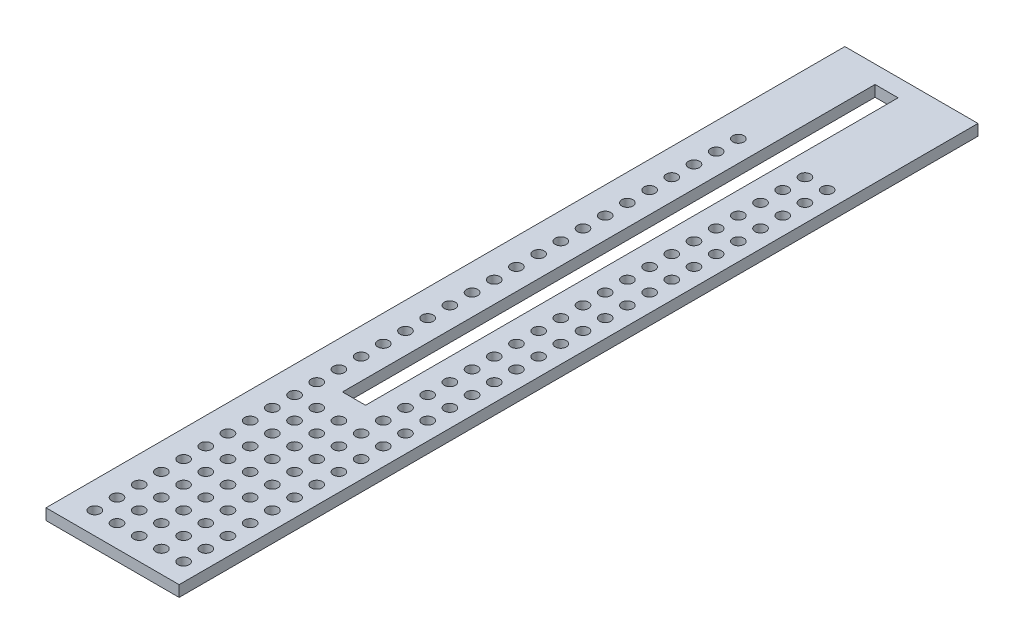
from build123d import *

# Parameters (mm, degrees)
BOSS_EXTRUDE1_DEPTH = 228.6
CUT_EXTRUDE1_REACH  = 239.256
SKETCH3_W           = 76.2
SKETCH3_H           = 6.35
SKETCH3_H_2         = 6.941694096
SKETCH4_R           = 1.5875
CUT_EXTRUDE2_DEPTH  = 3.175
CUT_EXTRUDE3_REACH  = 254.812
SKETCH5_W           = 6.604
SKETCH5_H           = 152.4
SKETCH6_R           = 1.5875
CUT_EXTRUDE4_DEPTH  = 3.175
CUT_EXTRUDE5_REACH  = 239.256
SKETCH7_W           = 228.6
SKETCH7_H           = 98.425


with BuildPart() as part:
    # Sketch1 → Boss-Extrude1 (new body)
    with BuildSketch(Plane.XY):
        Polygon((1.5875, 47.625), (36.5125, 47.625), (36.5125, 50.8), (-1.5875, 50.8), (-1.5875, -50.8), (1.5875, -50.8), align=None)
    extrude(amount=BOSS_EXTRUDE1_DEPTH)

    # Sketch3 → Cut-Extrude1 (cut, up to next)
    with BuildSketch(Plane.ZY.offset(1.5875), mode=Mode.PRIVATE) as cut_extrude1_sk1:
        with Locations((44.45, -35.56)):
            Rectangle(SKETCH3_W, SKETCH3_H)
    cut_extrude1_tool1 = extrude(cut_extrude1_sk1.sketch, amount=-CUT_EXTRUDE1_REACH, mode=Mode.PRIVATE) & part.part
    # Sketch3 → Cut-Extrude1 (cut, up to next)
    with BuildSketch(Plane.ZY.offset(1.5875), mode=Mode.PRIVATE) as cut_extrude1_sk2:
        with Locations((44.45, 29.718)):
            Rectangle(SKETCH3_W, SKETCH3_H_2)
    cut_extrude1_tool2 = extrude(cut_extrude1_sk2.sketch, amount=-CUT_EXTRUDE1_REACH, mode=Mode.PRIVATE) & part.part
    add(cut_extrude1_tool1.solids().sort_by_distance((-1.5875, -35.56, 44.45))[0], mode=Mode.SUBTRACT)
    add(cut_extrude1_tool2.solids().sort_by_distance((-1.5875, 29.718, 44.45))[0], mode=Mode.SUBTRACT)

    # Sketch4 → Cut-Extrude2 (cut)
    with BuildSketch(Plane.ZY.offset(1.5875)):
        with Locations(Location((103.818466909, 40.328941299, 0), (0, 0, 270))):
            Circle(SKETCH4_R)
        with Locations(Location((110.168466909, 40.328941299, 0), (0, 0, 270))):
            Circle(SKETCH4_R)
        with Locations(Location((116.518466909, 40.328941299, 0), (0, 0, 270))):
            Circle(SKETCH4_R)
        with Locations(Location((122.868466909, 40.328941299, 0), (0, 0, 270))):
            Circle(SKETCH4_R)
        with Locations(Location((129.218466909, 40.328941299, 0), (0, 0, 270))):
            Circle(SKETCH4_R)
        with Locations(Location((110.168466909, 33.978941299, 0), (0, 0, 270))):
            Circle(SKETCH4_R)
        with Locations(Location((116.518466909, 33.978941299, 0), (0, 0, 270))):
            Circle(SKETCH4_R)
        with Locations(Location((122.868466909, 33.978941299, 0), (0, 0, 270))):
            Circle(SKETCH4_R)
        with Locations(Location((129.218466909, 33.978941299, 0), (0, 0, 270))):
            Circle(SKETCH4_R)
        with Locations(Location((110.168466909, 27.628941299, 0), (0, 0, 270))):
            Circle(SKETCH4_R)
        with Locations(Location((116.518466909, 27.628941299, 0), (0, 0, 270))):
            Circle(SKETCH4_R)
        with Locations(Location((122.868466909, 27.628941299, 0), (0, 0, 270))):
            Circle(SKETCH4_R)
        with Locations(Location((129.218466909, 27.628941299, 0), (0, 0, 270))):
            Circle(SKETCH4_R)
        with Locations(Location((110.168466909, 21.278941299, 0), (0, 0, 270))):
            Circle(SKETCH4_R)
        with Locations(Location((116.518466909, 21.278941299, 0), (0, 0, 270))):
            Circle(SKETCH4_R)
        with Locations(Location((122.868466909, 21.278941299, 0), (0, 0, 270))):
            Circle(SKETCH4_R)
        with Locations(Location((129.218466909, 21.278941299, 0), (0, 0, 270))):
            Circle(SKETCH4_R)
        with Locations(Location((103.818466909, 33.978941299, 0), (0, 0, 270))):
            Circle(SKETCH4_R)
        with Locations(Location((103.818466909, 27.628941299, 0), (0, 0, 270))):
            Circle(SKETCH4_R)
        with Locations(Location((103.818466909, 21.278941299, 0), (0, 0, 270))):
            Circle(SKETCH4_R)
        with Locations(Location((135.568466909, 40.328941299, 0), (0, 0, 270))):
            Circle(SKETCH4_R)
        with Locations(Location((141.918466909, 40.328941299, 0), (0, 0, 270))):
            Circle(SKETCH4_R)
        with Locations(Location((148.268466909, 40.328941299, 0), (0, 0, 270))):
            Circle(SKETCH4_R)
        with Locations(Location((154.618466909, 40.328941299, 0), (0, 0, 270))):
            Circle(SKETCH4_R)
        with Locations(Location((160.968466909, 40.328941299, 0), (0, 0, 270))):
            Circle(SKETCH4_R)
        with Locations(Location((167.318466909, 40.328941299, 0), (0, 0, 270))):
            Circle(SKETCH4_R)
        with Locations(Location((173.668466909, 40.328941299, 0), (0, 0, 270))):
            Circle(SKETCH4_R)
        with Locations(Location((180.018466909, 40.328941299, 0), (0, 0, 270))):
            Circle(SKETCH4_R)
        with Locations(Location((186.368466909, 40.328941299, 0), (0, 0, 270))):
            Circle(SKETCH4_R)
        with Locations(Location((192.718466909, 40.328941299, 0), (0, 0, 270))):
            Circle(SKETCH4_R)
        with Locations(Location((199.068466909, 40.328941299, 0), (0, 0, 270))):
            Circle(SKETCH4_R)
        with Locations(Location((205.418466909, 40.328941299, 0), (0, 0, 270))):
            Circle(SKETCH4_R)
        with Locations(Location((211.768466909, 40.328941299, 0), (0, 0, 270))):
            Circle(SKETCH4_R)
        with Locations(Location((218.118466909, 40.328941299, 0), (0, 0, 270))):
            Circle(SKETCH4_R)
        with Locations(Location((135.568466909, 33.978941299, 0), (0, 0, 270))):
            Circle(SKETCH4_R)
        with Locations(Location((141.918466909, 33.978941299, 0), (0, 0, 270))):
            Circle(SKETCH4_R)
        with Locations(Location((148.268466909, 33.978941299, 0), (0, 0, 270))):
            Circle(SKETCH4_R)
        with Locations(Location((154.618466909, 33.978941299, 0), (0, 0, 270))):
            Circle(SKETCH4_R)
        with Locations(Location((160.968466909, 33.978941299, 0), (0, 0, 270))):
            Circle(SKETCH4_R)
        with Locations(Location((167.318466909, 33.978941299, 0), (0, 0, 270))):
            Circle(SKETCH4_R)
        with Locations(Location((173.668466909, 33.978941299, 0), (0, 0, 270))):
            Circle(SKETCH4_R)
        with Locations(Location((180.018466909, 33.978941299, 0), (0, 0, 270))):
            Circle(SKETCH4_R)
        with Locations(Location((186.368466909, 33.978941299, 0), (0, 0, 270))):
            Circle(SKETCH4_R)
        with Locations(Location((192.718466909, 33.978941299, 0), (0, 0, 270))):
            Circle(SKETCH4_R)
        with Locations(Location((199.068466909, 33.978941299, 0), (0, 0, 270))):
            Circle(SKETCH4_R)
        with Locations(Location((205.418466909, 33.978941299, 0), (0, 0, 270))):
            Circle(SKETCH4_R)
        with Locations(Location((211.768466909, 33.978941299, 0), (0, 0, 270))):
            Circle(SKETCH4_R)
        with Locations(Location((218.118466909, 33.978941299, 0), (0, 0, 270))):
            Circle(SKETCH4_R)
        with Locations(Location((135.568466909, 27.628941299, 0), (0, 0, 270))):
            Circle(SKETCH4_R)
        with Locations(Location((141.918466909, 27.628941299, 0), (0, 0, 270))):
            Circle(SKETCH4_R)
        with Locations(Location((148.268466909, 27.628941299, 0), (0, 0, 270))):
            Circle(SKETCH4_R)
        with Locations(Location((154.618466909, 27.628941299, 0), (0, 0, 270))):
            Circle(SKETCH4_R)
        with Locations(Location((160.968466909, 27.628941299, 0), (0, 0, 270))):
            Circle(SKETCH4_R)
        with Locations(Location((167.318466909, 27.628941299, 0), (0, 0, 270))):
            Circle(SKETCH4_R)
        with Locations(Location((173.668466909, 27.628941299, 0), (0, 0, 270))):
            Circle(SKETCH4_R)
        with Locations(Location((180.018466909, 27.628941299, 0), (0, 0, 270))):
            Circle(SKETCH4_R)
        with Locations(Location((186.368466909, 27.628941299, 0), (0, 0, 270))):
            Circle(SKETCH4_R)
        with Locations(Location((192.718466909, 27.628941299, 0), (0, 0, 270))):
            Circle(SKETCH4_R)
        with Locations(Location((199.068466909, 27.628941299, 0), (0, 0, 270))):
            Circle(SKETCH4_R)
        with Locations(Location((205.418466909, 27.628941299, 0), (0, 0, 270))):
            Circle(SKETCH4_R)
        with Locations(Location((211.768466909, 27.628941299, 0), (0, 0, 270))):
            Circle(SKETCH4_R)
        with Locations(Location((218.118466909, 27.628941299, 0), (0, 0, 270))):
            Circle(SKETCH4_R)
        with Locations(Location((135.568466909, 21.278941299, 0), (0, 0, 270))):
            Circle(SKETCH4_R)
        with Locations(Location((141.918466909, 21.278941299, 0), (0, 0, 270))):
            Circle(SKETCH4_R)
        with Locations(Location((148.268466909, 21.278941299, 0), (0, 0, 270))):
            Circle(SKETCH4_R)
        with Locations(Location((154.618466909, 21.278941299, 0), (0, 0, 270))):
            Circle(SKETCH4_R)
        with Locations(Location((160.968466909, 21.278941299, 0), (0, 0, 270))):
            Circle(SKETCH4_R)
        with Locations(Location((167.318466909, 21.278941299, 0), (0, 0, 270))):
            Circle(SKETCH4_R)
        with Locations(Location((173.668466909, 21.278941299, 0), (0, 0, 270))):
            Circle(SKETCH4_R)
        with Locations(Location((180.018466909, 21.278941299, 0), (0, 0, 270))):
            Circle(SKETCH4_R)
        with Locations(Location((186.368466909, 21.278941299, 0), (0, 0, 270))):
            Circle(SKETCH4_R)
        with Locations(Location((192.718466909, 21.278941299, 0), (0, 0, 270))):
            Circle(SKETCH4_R)
        with Locations(Location((199.068466909, 21.278941299, 0), (0, 0, 270))):
            Circle(SKETCH4_R)
        with Locations(Location((205.418466909, 21.278941299, 0), (0, 0, 270))):
            Circle(SKETCH4_R)
        with Locations(Location((211.768466909, 21.278941299, 0), (0, 0, 270))):
            Circle(SKETCH4_R)
        with Locations(Location((218.118466909, 21.278941299, 0), (0, 0, 270))):
            Circle(SKETCH4_R)
        with Locations(Location((103.818466909, 14.928941299, 0), (0, 0, 270))):
            Circle(SKETCH4_R)
        with Locations(Location((110.168466909, 14.928941299, 0), (0, 0, 270))):
            Circle(SKETCH4_R)
        with Locations(Location((116.518466909, 14.928941299, 0), (0, 0, 270))):
            Circle(SKETCH4_R)
        with Locations(Location((122.868466909, 14.928941299, 0), (0, 0, 270))):
            Circle(SKETCH4_R)
        with Locations(Location((129.218466909, 14.928941299, 0), (0, 0, 270))):
            Circle(SKETCH4_R)
        with Locations(Location((135.568466909, 14.928941299, 0), (0, 0, 270))):
            Circle(SKETCH4_R)
        with Locations(Location((141.918466909, 14.928941299, 0), (0, 0, 270))):
            Circle(SKETCH4_R)
        with Locations(Location((148.268466909, 14.928941299, 0), (0, 0, 270))):
            Circle(SKETCH4_R)
        with Locations(Location((154.618466909, 14.928941299, 0), (0, 0, 270))):
            Circle(SKETCH4_R)
        with Locations(Location((160.968466909, 14.928941299, 0), (0, 0, 270))):
            Circle(SKETCH4_R)
        with Locations(Location((167.318466909, 14.928941299, 0), (0, 0, 270))):
            Circle(SKETCH4_R)
        with Locations(Location((173.668466909, 14.928941299, 0), (0, 0, 270))):
            Circle(SKETCH4_R)
        with Locations(Location((180.018466909, 14.928941299, 0), (0, 0, 270))):
            Circle(SKETCH4_R)
        with Locations(Location((186.368466909, 14.928941299, 0), (0, 0, 270))):
            Circle(SKETCH4_R)
        with Locations(Location((192.718466909, 14.928941299, 0), (0, 0, 270))):
            Circle(SKETCH4_R)
        with Locations(Location((199.068466909, 14.928941299, 0), (0, 0, 270))):
            Circle(SKETCH4_R)
        with Locations(Location((205.418466909, 14.928941299, 0), (0, 0, 270))):
            Circle(SKETCH4_R)
        with Locations(Location((211.768466909, 14.928941299, 0), (0, 0, 270))):
            Circle(SKETCH4_R)
        with Locations(Location((218.118466909, 14.928941299, 0), (0, 0, 270))):
            Circle(SKETCH4_R)
        with Locations(Location((103.818466909, 8.578941299, 0), (0, 0, 270))):
            Circle(SKETCH4_R)
        with Locations(Location((110.168466909, 8.578941299, 0), (0, 0, 270))):
            Circle(SKETCH4_R)
        with Locations(Location((116.518466909, 8.578941299, 0), (0, 0, 270))):
            Circle(SKETCH4_R)
        with Locations(Location((122.868466909, 8.578941299, 0), (0, 0, 270))):
            Circle(SKETCH4_R)
        with Locations(Location((129.218466909, 8.578941299, 0), (0, 0, 270))):
            Circle(SKETCH4_R)
        with Locations(Location((135.568466909, 8.578941299, 0), (0, 0, 270))):
            Circle(SKETCH4_R)
        with Locations(Location((141.918466909, 8.578941299, 0), (0, 0, 270))):
            Circle(SKETCH4_R)
        with Locations(Location((148.268466909, 8.578941299, 0), (0, 0, 270))):
            Circle(SKETCH4_R)
        with Locations(Location((154.618466909, 8.578941299, 0), (0, 0, 270))):
            Circle(SKETCH4_R)
        with Locations(Location((160.968466909, 8.578941299, 0), (0, 0, 270))):
            Circle(SKETCH4_R)
        with Locations(Location((167.318466909, 8.578941299, 0), (0, 0, 270))):
            Circle(SKETCH4_R)
        with Locations(Location((173.668466909, 8.578941299, 0), (0, 0, 270))):
            Circle(SKETCH4_R)
        with Locations(Location((180.018466909, 8.578941299, 0), (0, 0, 270))):
            Circle(SKETCH4_R)
        with Locations(Location((186.368466909, 8.578941299, 0), (0, 0, 270))):
            Circle(SKETCH4_R)
        with Locations(Location((192.718466909, 8.578941299, 0), (0, 0, 270))):
            Circle(SKETCH4_R)
        with Locations(Location((199.068466909, 8.578941299, 0), (0, 0, 270))):
            Circle(SKETCH4_R)
        with Locations(Location((205.418466909, 8.578941299, 0), (0, 0, 270))):
            Circle(SKETCH4_R)
        with Locations(Location((211.768466909, 8.578941299, 0), (0, 0, 270))):
            Circle(SKETCH4_R)
        with Locations(Location((218.118466909, 8.578941299, 0), (0, 0, 270))):
            Circle(SKETCH4_R)
        with Locations(Location((103.818466909, 2.228941299, 0), (0, 0, 270))):
            Circle(SKETCH4_R)
        with Locations(Location((110.168466909, 2.228941299, 0), (0, 0, 270))):
            Circle(SKETCH4_R)
        with Locations(Location((116.518466909, 2.228941299, 0), (0, 0, 270))):
            Circle(SKETCH4_R)
        with Locations(Location((122.868466909, 2.228941299, 0), (0, 0, 270))):
            Circle(SKETCH4_R)
        with Locations(Location((129.218466909, 2.228941299, 0), (0, 0, 270))):
            Circle(SKETCH4_R)
        with Locations(Location((135.568466909, 2.228941299, 0), (0, 0, 270))):
            Circle(SKETCH4_R)
        with Locations(Location((141.918466909, 2.228941299, 0), (0, 0, 270))):
            Circle(SKETCH4_R)
        with Locations(Location((148.268466909, 2.228941299, 0), (0, 0, 270))):
            Circle(SKETCH4_R)
        with Locations(Location((154.618466909, 2.228941299, 0), (0, 0, 270))):
            Circle(SKETCH4_R)
        with Locations(Location((160.968466909, 2.228941299, 0), (0, 0, 270))):
            Circle(SKETCH4_R)
        with Locations(Location((167.318466909, 2.228941299, 0), (0, 0, 270))):
            Circle(SKETCH4_R)
        with Locations(Location((173.668466909, 2.228941299, 0), (0, 0, 270))):
            Circle(SKETCH4_R)
        with Locations(Location((180.018466909, 2.228941299, 0), (0, 0, 270))):
            Circle(SKETCH4_R)
        with Locations(Location((186.368466909, 2.228941299, 0), (0, 0, 270))):
            Circle(SKETCH4_R)
        with Locations(Location((192.718466909, 2.228941299, 0), (0, 0, 270))):
            Circle(SKETCH4_R)
        with Locations(Location((199.068466909, 2.228941299, 0), (0, 0, 270))):
            Circle(SKETCH4_R)
        with Locations(Location((205.418466909, 2.228941299, 0), (0, 0, 270))):
            Circle(SKETCH4_R)
        with Locations(Location((211.768466909, 2.228941299, 0), (0, 0, 270))):
            Circle(SKETCH4_R)
        with Locations(Location((218.118466909, 2.228941299, 0), (0, 0, 270))):
            Circle(SKETCH4_R)
        with Locations(Location((103.818466909, -4.121058701, 0), (0, 0, 270))):
            Circle(SKETCH4_R)
        with Locations(Location((110.168466909, -4.121058701, 0), (0, 0, 270))):
            Circle(SKETCH4_R)
        with Locations(Location((116.518466909, -4.121058701, 0), (0, 0, 270))):
            Circle(SKETCH4_R)
        with Locations(Location((122.868466909, -4.121058701, 0), (0, 0, 270))):
            Circle(SKETCH4_R)
        with Locations(Location((129.218466909, -4.121058701, 0), (0, 0, 270))):
            Circle(SKETCH4_R)
        with Locations(Location((135.568466909, -4.121058701, 0), (0, 0, 270))):
            Circle(SKETCH4_R)
        with Locations(Location((141.918466909, -4.121058701, 0), (0, 0, 270))):
            Circle(SKETCH4_R)
        with Locations(Location((148.268466909, -4.121058701, 0), (0, 0, 270))):
            Circle(SKETCH4_R)
        with Locations(Location((154.618466909, -4.121058701, 0), (0, 0, 270))):
            Circle(SKETCH4_R)
        with Locations(Location((160.968466909, -4.121058701, 0), (0, 0, 270))):
            Circle(SKETCH4_R)
        with Locations(Location((167.318466909, -4.121058701, 0), (0, 0, 270))):
            Circle(SKETCH4_R)
        with Locations(Location((173.668466909, -4.121058701, 0), (0, 0, 270))):
            Circle(SKETCH4_R)
        with Locations(Location((180.018466909, -4.121058701, 0), (0, 0, 270))):
            Circle(SKETCH4_R)
        with Locations(Location((186.368466909, -4.121058701, 0), (0, 0, 270))):
            Circle(SKETCH4_R)
        with Locations(Location((192.718466909, -4.121058701, 0), (0, 0, 270))):
            Circle(SKETCH4_R)
        with Locations(Location((199.068466909, -4.121058701, 0), (0, 0, 270))):
            Circle(SKETCH4_R)
        with Locations(Location((205.418466909, -4.121058701, 0), (0, 0, 270))):
            Circle(SKETCH4_R)
        with Locations(Location((211.768466909, -4.121058701, 0), (0, 0, 270))):
            Circle(SKETCH4_R)
        with Locations(Location((218.118466909, -4.121058701, 0), (0, 0, 270))):
            Circle(SKETCH4_R)
        with Locations(Location((103.818466909, -10.471058701, 0), (0, 0, 270))):
            Circle(SKETCH4_R)
        with Locations(Location((110.168466909, -10.471058701, 0), (0, 0, 270))):
            Circle(SKETCH4_R)
        with Locations(Location((116.518466909, -10.471058701, 0), (0, 0, 270))):
            Circle(SKETCH4_R)
        with Locations(Location((122.868466909, -10.471058701, 0), (0, 0, 270))):
            Circle(SKETCH4_R)
        with Locations(Location((129.218466909, -10.471058701, 0), (0, 0, 270))):
            Circle(SKETCH4_R)
        with Locations(Location((135.568466909, -10.471058701, 0), (0, 0, 270))):
            Circle(SKETCH4_R)
        with Locations(Location((141.918466909, -10.471058701, 0), (0, 0, 270))):
            Circle(SKETCH4_R)
        with Locations(Location((148.268466909, -10.471058701, 0), (0, 0, 270))):
            Circle(SKETCH4_R)
        with Locations(Location((154.618466909, -10.471058701, 0), (0, 0, 270))):
            Circle(SKETCH4_R)
        with Locations(Location((160.968466909, -10.471058701, 0), (0, 0, 270))):
            Circle(SKETCH4_R)
        with Locations(Location((167.318466909, -10.471058701, 0), (0, 0, 270))):
            Circle(SKETCH4_R)
        with Locations(Location((173.668466909, -10.471058701, 0), (0, 0, 270))):
            Circle(SKETCH4_R)
        with Locations(Location((180.018466909, -10.471058701, 0), (0, 0, 270))):
            Circle(SKETCH4_R)
        with Locations(Location((186.368466909, -10.471058701, 0), (0, 0, 270))):
            Circle(SKETCH4_R)
        with Locations(Location((192.718466909, -10.471058701, 0), (0, 0, 270))):
            Circle(SKETCH4_R)
        with Locations(Location((199.068466909, -10.471058701, 0), (0, 0, 270))):
            Circle(SKETCH4_R)
        with Locations(Location((205.418466909, -10.471058701, 0), (0, 0, 270))):
            Circle(SKETCH4_R)
        with Locations(Location((211.768466909, -10.471058701, 0), (0, 0, 270))):
            Circle(SKETCH4_R)
        with Locations(Location((218.118466909, -10.471058701, 0), (0, 0, 270))):
            Circle(SKETCH4_R)
        with Locations(Location((103.818466909, -16.821058701, 0), (0, 0, 270))):
            Circle(SKETCH4_R)
        with Locations(Location((110.168466909, -16.821058701, 0), (0, 0, 270))):
            Circle(SKETCH4_R)
        with Locations(Location((116.518466909, -16.821058701, 0), (0, 0, 270))):
            Circle(SKETCH4_R)
        with Locations(Location((122.868466909, -16.821058701, 0), (0, 0, 270))):
            Circle(SKETCH4_R)
        with Locations(Location((129.218466909, -16.821058701, 0), (0, 0, 270))):
            Circle(SKETCH4_R)
        with Locations(Location((135.568466909, -16.821058701, 0), (0, 0, 270))):
            Circle(SKETCH4_R)
        with Locations(Location((141.918466909, -16.821058701, 0), (0, 0, 270))):
            Circle(SKETCH4_R)
        with Locations(Location((148.268466909, -16.821058701, 0), (0, 0, 270))):
            Circle(SKETCH4_R)
        with Locations(Location((154.618466909, -16.821058701, 0), (0, 0, 270))):
            Circle(SKETCH4_R)
        with Locations(Location((160.968466909, -16.821058701, 0), (0, 0, 270))):
            Circle(SKETCH4_R)
        with Locations(Location((167.318466909, -16.821058701, 0), (0, 0, 270))):
            Circle(SKETCH4_R)
        with Locations(Location((173.668466909, -16.821058701, 0), (0, 0, 270))):
            Circle(SKETCH4_R)
        with Locations(Location((180.018466909, -16.821058701, 0), (0, 0, 270))):
            Circle(SKETCH4_R)
        with Locations(Location((186.368466909, -16.821058701, 0), (0, 0, 270))):
            Circle(SKETCH4_R)
        with Locations(Location((192.718466909, -16.821058701, 0), (0, 0, 270))):
            Circle(SKETCH4_R)
        with Locations(Location((199.068466909, -16.821058701, 0), (0, 0, 270))):
            Circle(SKETCH4_R)
        with Locations(Location((205.418466909, -16.821058701, 0), (0, 0, 270))):
            Circle(SKETCH4_R)
        with Locations(Location((211.768466909, -16.821058701, 0), (0, 0, 270))):
            Circle(SKETCH4_R)
        with Locations(Location((218.118466909, -16.821058701, 0), (0, 0, 270))):
            Circle(SKETCH4_R)
        with Locations(Location((103.818466909, -23.171058701, 0), (0, 0, 270))):
            Circle(SKETCH4_R)
        with Locations(Location((110.168466909, -23.171058701, 0), (0, 0, 270))):
            Circle(SKETCH4_R)
        with Locations(Location((116.518466909, -23.171058701, 0), (0, 0, 270))):
            Circle(SKETCH4_R)
        with Locations(Location((122.868466909, -23.171058701, 0), (0, 0, 270))):
            Circle(SKETCH4_R)
        with Locations(Location((129.218466909, -23.171058701, 0), (0, 0, 270))):
            Circle(SKETCH4_R)
        with Locations(Location((135.568466909, -23.171058701, 0), (0, 0, 270))):
            Circle(SKETCH4_R)
        with Locations(Location((141.918466909, -23.171058701, 0), (0, 0, 270))):
            Circle(SKETCH4_R)
        with Locations(Location((148.268466909, -23.171058701, 0), (0, 0, 270))):
            Circle(SKETCH4_R)
        with Locations(Location((154.618466909, -23.171058701, 0), (0, 0, 270))):
            Circle(SKETCH4_R)
        with Locations(Location((160.968466909, -23.171058701, 0), (0, 0, 270))):
            Circle(SKETCH4_R)
        with Locations(Location((167.318466909, -23.171058701, 0), (0, 0, 270))):
            Circle(SKETCH4_R)
        with Locations(Location((173.668466909, -23.171058701, 0), (0, 0, 270))):
            Circle(SKETCH4_R)
        with Locations(Location((180.018466909, -23.171058701, 0), (0, 0, 270))):
            Circle(SKETCH4_R)
        with Locations(Location((186.368466909, -23.171058701, 0), (0, 0, 270))):
            Circle(SKETCH4_R)
        with Locations(Location((192.718466909, -23.171058701, 0), (0, 0, 270))):
            Circle(SKETCH4_R)
        with Locations(Location((199.068466909, -23.171058701, 0), (0, 0, 270))):
            Circle(SKETCH4_R)
        with Locations(Location((205.418466909, -23.171058701, 0), (0, 0, 270))):
            Circle(SKETCH4_R)
        with Locations(Location((211.768466909, -23.171058701, 0), (0, 0, 270))):
            Circle(SKETCH4_R)
        with Locations(Location((218.118466909, -23.171058701, 0), (0, 0, 270))):
            Circle(SKETCH4_R)
        with Locations(Location((103.818466909, -29.521058701, 0), (0, 0, 270))):
            Circle(SKETCH4_R)
        with Locations(Location((110.168466909, -29.521058701, 0), (0, 0, 270))):
            Circle(SKETCH4_R)
        with Locations(Location((116.518466909, -29.521058701, 0), (0, 0, 270))):
            Circle(SKETCH4_R)
        with Locations(Location((122.868466909, -29.521058701, 0), (0, 0, 270))):
            Circle(SKETCH4_R)
        with Locations(Location((129.218466909, -29.521058701, 0), (0, 0, 270))):
            Circle(SKETCH4_R)
        with Locations(Location((135.568466909, -29.521058701, 0), (0, 0, 270))):
            Circle(SKETCH4_R)
        with Locations(Location((141.918466909, -29.521058701, 0), (0, 0, 270))):
            Circle(SKETCH4_R)
        with Locations(Location((148.268466909, -29.521058701, 0), (0, 0, 270))):
            Circle(SKETCH4_R)
        with Locations(Location((154.618466909, -29.521058701, 0), (0, 0, 270))):
            Circle(SKETCH4_R)
        with Locations(Location((160.968466909, -29.521058701, 0), (0, 0, 270))):
            Circle(SKETCH4_R)
        with Locations(Location((167.318466909, -29.521058701, 0), (0, 0, 270))):
            Circle(SKETCH4_R)
        with Locations(Location((173.668466909, -29.521058701, 0), (0, 0, 270))):
            Circle(SKETCH4_R)
        with Locations(Location((180.018466909, -29.521058701, 0), (0, 0, 270))):
            Circle(SKETCH4_R)
        with Locations(Location((186.368466909, -29.521058701, 0), (0, 0, 270))):
            Circle(SKETCH4_R)
        with Locations(Location((192.718466909, -29.521058701, 0), (0, 0, 270))):
            Circle(SKETCH4_R)
        with Locations(Location((199.068466909, -29.521058701, 0), (0, 0, 270))):
            Circle(SKETCH4_R)
        with Locations(Location((205.418466909, -29.521058701, 0), (0, 0, 270))):
            Circle(SKETCH4_R)
        with Locations(Location((211.768466909, -29.521058701, 0), (0, 0, 270))):
            Circle(SKETCH4_R)
        with Locations(Location((218.118466909, -29.521058701, 0), (0, 0, 270))):
            Circle(SKETCH4_R)
        with Locations(Location((103.818466909, -35.871058701, 0), (0, 0, 270))):
            Circle(SKETCH4_R)
        with Locations(Location((110.168466909, -35.871058701, 0), (0, 0, 270))):
            Circle(SKETCH4_R)
        with Locations(Location((116.518466909, -35.871058701, 0), (0, 0, 270))):
            Circle(SKETCH4_R)
        with Locations(Location((122.868466909, -35.871058701, 0), (0, 0, 270))):
            Circle(SKETCH4_R)
        with Locations(Location((129.218466909, -35.871058701, 0), (0, 0, 270))):
            Circle(SKETCH4_R)
        with Locations(Location((135.568466909, -35.871058701, 0), (0, 0, 270))):
            Circle(SKETCH4_R)
        with Locations(Location((141.918466909, -35.871058701, 0), (0, 0, 270))):
            Circle(SKETCH4_R)
        with Locations(Location((148.268466909, -35.871058701, 0), (0, 0, 270))):
            Circle(SKETCH4_R)
        with Locations(Location((154.618466909, -35.871058701, 0), (0, 0, 270))):
            Circle(SKETCH4_R)
        with Locations(Location((160.968466909, -35.871058701, 0), (0, 0, 270))):
            Circle(SKETCH4_R)
        with Locations(Location((167.318466909, -35.871058701, 0), (0, 0, 270))):
            Circle(SKETCH4_R)
        with Locations(Location((173.668466909, -35.871058701, 0), (0, 0, 270))):
            Circle(SKETCH4_R)
        with Locations(Location((180.018466909, -35.871058701, 0), (0, 0, 270))):
            Circle(SKETCH4_R)
        with Locations(Location((186.368466909, -35.871058701, 0), (0, 0, 270))):
            Circle(SKETCH4_R)
        with Locations(Location((192.718466909, -35.871058701, 0), (0, 0, 270))):
            Circle(SKETCH4_R)
        with Locations(Location((199.068466909, -35.871058701, 0), (0, 0, 270))):
            Circle(SKETCH4_R)
        with Locations(Location((205.418466909, -35.871058701, 0), (0, 0, 270))):
            Circle(SKETCH4_R)
        with Locations(Location((211.768466909, -35.871058701, 0), (0, 0, 270))):
            Circle(SKETCH4_R)
        with Locations(Location((218.118466909, -35.871058701, 0), (0, 0, 270))):
            Circle(SKETCH4_R)
        with Locations(Location((103.818466909, -42.221058701, 0), (0, 0, 270))):
            Circle(SKETCH4_R)
        with Locations(Location((110.168466909, -42.221058701, 0), (0, 0, 270))):
            Circle(SKETCH4_R)
        with Locations(Location((116.518466909, -42.221058701, 0), (0, 0, 270))):
            Circle(SKETCH4_R)
        with Locations(Location((122.868466909, -42.221058701, 0), (0, 0, 270))):
            Circle(SKETCH4_R)
        with Locations(Location((129.218466909, -42.221058701, 0), (0, 0, 270))):
            Circle(SKETCH4_R)
        with Locations(Location((135.568466909, -42.221058701, 0), (0, 0, 270))):
            Circle(SKETCH4_R)
        with Locations(Location((141.918466909, -42.221058701, 0), (0, 0, 270))):
            Circle(SKETCH4_R)
        with Locations(Location((148.268466909, -42.221058701, 0), (0, 0, 270))):
            Circle(SKETCH4_R)
        with Locations(Location((154.618466909, -42.221058701, 0), (0, 0, 270))):
            Circle(SKETCH4_R)
        with Locations(Location((160.968466909, -42.221058701, 0), (0, 0, 270))):
            Circle(SKETCH4_R)
        with Locations(Location((167.318466909, -42.221058701, 0), (0, 0, 270))):
            Circle(SKETCH4_R)
        with Locations(Location((173.668466909, -42.221058701, 0), (0, 0, 270))):
            Circle(SKETCH4_R)
        with Locations(Location((180.018466909, -42.221058701, 0), (0, 0, 270))):
            Circle(SKETCH4_R)
        with Locations(Location((186.368466909, -42.221058701, 0), (0, 0, 270))):
            Circle(SKETCH4_R)
        with Locations(Location((192.718466909, -42.221058701, 0), (0, 0, 270))):
            Circle(SKETCH4_R)
        with Locations(Location((199.068466909, -42.221058701, 0), (0, 0, 270))):
            Circle(SKETCH4_R)
        with Locations(Location((205.418466909, -42.221058701, 0), (0, 0, 270))):
            Circle(SKETCH4_R)
        with Locations(Location((211.768466909, -42.221058701, 0), (0, 0, 270))):
            Circle(SKETCH4_R)
        with Locations(Location((218.118466909, -42.221058701, 0), (0, 0, 270))):
            Circle(SKETCH4_R)
    extrude(amount=-CUT_EXTRUDE2_DEPTH, mode=Mode.SUBTRACT)

    # Sketch5 → Cut-Extrude3 (cut, up to next)
    with BuildSketch(Plane(origin=(0, 50.8, 0), x_dir=(1, 0, 0), z_dir=(0, 1, 0)), mode=Mode.PRIVATE) as cut_extrude3_sk1:
        with Locations((15.4305, -81.28)):
            Rectangle(SKETCH5_W, SKETCH5_H)
    cut_extrude3_tool1 = extrude(cut_extrude3_sk1.sketch, amount=-CUT_EXTRUDE3_REACH, mode=Mode.PRIVATE) & part.part
    add(cut_extrude3_tool1.solids().sort_by_distance((15.4305, 50.8, 81.28))[0], mode=Mode.SUBTRACT)

    # Sketch6 → Cut-Extrude4 (cut)
    with BuildSketch(Plane(origin=(0, 50.8, 0), x_dir=(1, 0, 0), z_dir=(0, 1, 0))):
        with Locations(Location((6.0325, -222.25, 0), (0, 0, 180))):
            Circle(SKETCH6_R)
        with Locations(Location((12.3825, -222.25, 0), (0, 0, 180))):
            Circle(SKETCH6_R)
        with Locations(Location((18.7325, -222.25, 0), (0, 0, 180))):
            Circle(SKETCH6_R)
        with Locations(Location((25.0825, -222.25, 0), (0, 0, 180))):
            Circle(SKETCH6_R)
        with Locations(Location((31.4325, -222.25, 0), (0, 0, 180))):
            Circle(SKETCH6_R)
        with Locations(Location((12.3825, -215.9, 0), (0, 0, 180))):
            Circle(SKETCH6_R)
        with Locations(Location((18.7325, -215.9, 0), (0, 0, 180))):
            Circle(SKETCH6_R)
        with Locations(Location((25.0825, -215.9, 0), (0, 0, 180))):
            Circle(SKETCH6_R)
        with Locations(Location((31.4325, -215.9, 0), (0, 0, 180))):
            Circle(SKETCH6_R)
        with Locations(Location((12.3825, -209.55, 0), (0, 0, 180))):
            Circle(SKETCH6_R)
        with Locations(Location((18.7325, -209.55, 0), (0, 0, 180))):
            Circle(SKETCH6_R)
        with Locations(Location((25.0825, -209.55, 0), (0, 0, 180))):
            Circle(SKETCH6_R)
        with Locations(Location((31.4325, -209.55, 0), (0, 0, 180))):
            Circle(SKETCH6_R)
        with Locations(Location((12.3825, -203.2, 0), (0, 0, 180))):
            Circle(SKETCH6_R)
        with Locations(Location((18.7325, -203.2, 0), (0, 0, 180))):
            Circle(SKETCH6_R)
        with Locations(Location((25.0825, -203.2, 0), (0, 0, 180))):
            Circle(SKETCH6_R)
        with Locations(Location((31.4325, -203.2, 0), (0, 0, 180))):
            Circle(SKETCH6_R)
        with Locations(Location((12.3825, -196.85, 0), (0, 0, 180))):
            Circle(SKETCH6_R)
        with Locations(Location((18.7325, -196.85, 0), (0, 0, 180))):
            Circle(SKETCH6_R)
        with Locations(Location((25.0825, -196.85, 0), (0, 0, 180))):
            Circle(SKETCH6_R)
        with Locations(Location((31.4325, -196.85, 0), (0, 0, 180))):
            Circle(SKETCH6_R)
        with Locations(Location((12.3825, -190.5, 0), (0, 0, 180))):
            Circle(SKETCH6_R)
        with Locations(Location((18.7325, -190.5, 0), (0, 0, 180))):
            Circle(SKETCH6_R)
        with Locations(Location((25.0825, -190.5, 0), (0, 0, 180))):
            Circle(SKETCH6_R)
        with Locations(Location((31.4325, -190.5, 0), (0, 0, 180))):
            Circle(SKETCH6_R)
        with Locations(Location((12.3825, -184.15, 0), (0, 0, 180))):
            Circle(SKETCH6_R)
        with Locations(Location((18.7325, -184.15, 0), (0, 0, 180))):
            Circle(SKETCH6_R)
        with Locations(Location((25.0825, -184.15, 0), (0, 0, 180))):
            Circle(SKETCH6_R)
        with Locations(Location((31.4325, -184.15, 0), (0, 0, 180))):
            Circle(SKETCH6_R)
        with Locations(Location((12.3825, -177.8, 0), (0, 0, 180))):
            Circle(SKETCH6_R)
        with Locations(Location((18.7325, -177.8, 0), (0, 0, 180))):
            Circle(SKETCH6_R)
        with Locations(Location((25.0825, -177.8, 0), (0, 0, 180))):
            Circle(SKETCH6_R)
        with Locations(Location((31.4325, -177.8, 0), (0, 0, 180))):
            Circle(SKETCH6_R)
        with Locations(Location((12.3825, -171.45, 0), (0, 0, 180))):
            Circle(SKETCH6_R)
        with Locations(Location((18.7325, -171.45, 0), (0, 0, 180))):
            Circle(SKETCH6_R)
        with Locations(Location((25.0825, -171.45, 0), (0, 0, 180))):
            Circle(SKETCH6_R)
        with Locations(Location((31.4325, -171.45, 0), (0, 0, 180))):
            Circle(SKETCH6_R)
        with Locations(Location((12.3825, -165.1, 0), (0, 0, 180))):
            Circle(SKETCH6_R)
        with Locations(Location((18.7325, -165.1, 0), (0, 0, 180))):
            Circle(SKETCH6_R)
        with Locations(Location((25.0825, -165.1, 0), (0, 0, 180))):
            Circle(SKETCH6_R)
        with Locations(Location((31.4325, -165.1, 0), (0, 0, 180))):
            Circle(SKETCH6_R)
        with Locations(Location((25.0825, -158.75, 0), (0, 0, 180))):
            Circle(SKETCH6_R)
        with Locations(Location((31.4325, -158.75, 0), (0, 0, 180))):
            Circle(SKETCH6_R)
        with Locations(Location((25.0825, -152.4, 0), (0, 0, 180))):
            Circle(SKETCH6_R)
        with Locations(Location((31.4325, -152.4, 0), (0, 0, 180))):
            Circle(SKETCH6_R)
        with Locations(Location((25.0825, -146.05, 0), (0, 0, 180))):
            Circle(SKETCH6_R)
        with Locations(Location((31.4325, -146.05, 0), (0, 0, 180))):
            Circle(SKETCH6_R)
        with Locations(Location((25.0825, -139.7, 0), (0, 0, 180))):
            Circle(SKETCH6_R)
        with Locations(Location((31.4325, -139.7, 0), (0, 0, 180))):
            Circle(SKETCH6_R)
        with Locations(Location((25.0825, -133.35, 0), (0, 0, 180))):
            Circle(SKETCH6_R)
        with Locations(Location((31.4325, -133.35, 0), (0, 0, 180))):
            Circle(SKETCH6_R)
        with Locations(Location((25.0825, -127, 0), (0, 0, 180))):
            Circle(SKETCH6_R)
        with Locations(Location((31.4325, -127, 0), (0, 0, 180))):
            Circle(SKETCH6_R)
        with Locations(Location((25.0825, -120.65, 0), (0, 0, 180))):
            Circle(SKETCH6_R)
        with Locations(Location((31.4325, -120.65, 0), (0, 0, 180))):
            Circle(SKETCH6_R)
        with Locations(Location((25.0825, -114.3, 0), (0, 0, 180))):
            Circle(SKETCH6_R)
        with Locations(Location((31.4325, -114.3, 0), (0, 0, 180))):
            Circle(SKETCH6_R)
        with Locations(Location((25.0825, -107.95, 0), (0, 0, 180))):
            Circle(SKETCH6_R)
        with Locations(Location((31.4325, -107.95, 0), (0, 0, 180))):
            Circle(SKETCH6_R)
        with Locations(Location((25.0825, -101.6, 0), (0, 0, 180))):
            Circle(SKETCH6_R)
        with Locations(Location((31.4325, -101.6, 0), (0, 0, 180))):
            Circle(SKETCH6_R)
        with Locations(Location((25.0825, -95.25, 0), (0, 0, 180))):
            Circle(SKETCH6_R)
        with Locations(Location((31.4325, -95.25, 0), (0, 0, 180))):
            Circle(SKETCH6_R)
        with Locations(Location((25.0825, -88.9, 0), (0, 0, 180))):
            Circle(SKETCH6_R)
        with Locations(Location((31.4325, -88.9, 0), (0, 0, 180))):
            Circle(SKETCH6_R)
        with Locations(Location((25.0825, -82.55, 0), (0, 0, 180))):
            Circle(SKETCH6_R)
        with Locations(Location((31.4325, -82.55, 0), (0, 0, 180))):
            Circle(SKETCH6_R)
        with Locations(Location((25.0825, -76.2, 0), (0, 0, 180))):
            Circle(SKETCH6_R)
        with Locations(Location((31.4325, -76.2, 0), (0, 0, 180))):
            Circle(SKETCH6_R)
        with Locations(Location((25.0825, -69.85, 0), (0, 0, 180))):
            Circle(SKETCH6_R)
        with Locations(Location((31.4325, -69.85, 0), (0, 0, 180))):
            Circle(SKETCH6_R)
        with Locations(Location((25.0825, -63.5, 0), (0, 0, 180))):
            Circle(SKETCH6_R)
        with Locations(Location((31.4325, -63.5, 0), (0, 0, 180))):
            Circle(SKETCH6_R)
        with Locations(Location((25.0825, -57.15, 0), (0, 0, 180))):
            Circle(SKETCH6_R)
        with Locations(Location((31.4325, -57.15, 0), (0, 0, 180))):
            Circle(SKETCH6_R)
        with Locations(Location((25.0825, -50.8, 0), (0, 0, 180))):
            Circle(SKETCH6_R)
        with Locations(Location((31.4325, -50.8, 0), (0, 0, 180))):
            Circle(SKETCH6_R)
        with Locations(Location((25.0825, -44.45, 0), (0, 0, 180))):
            Circle(SKETCH6_R)
        with Locations(Location((31.4325, -44.45, 0), (0, 0, 180))):
            Circle(SKETCH6_R)
        with Locations(Location((25.0825, -38.1, 0), (0, 0, 180))):
            Circle(SKETCH6_R)
        with Locations(Location((31.4325, -38.1, 0), (0, 0, 180))):
            Circle(SKETCH6_R)
        with Locations(Location((6.0325, -215.9, 0), (0, 0, 180))):
            Circle(SKETCH6_R)
        with Locations(Location((6.0325, -209.55, 0), (0, 0, 180))):
            Circle(SKETCH6_R)
        with Locations(Location((6.0325, -203.2, 0), (0, 0, 180))):
            Circle(SKETCH6_R)
        with Locations(Location((6.0325, -196.85, 0), (0, 0, 180))):
            Circle(SKETCH6_R)
        with Locations(Location((6.0325, -190.5, 0), (0, 0, 180))):
            Circle(SKETCH6_R)
        with Locations(Location((6.0325, -184.15, 0), (0, 0, 180))):
            Circle(SKETCH6_R)
        with Locations(Location((6.0325, -177.8, 0), (0, 0, 180))):
            Circle(SKETCH6_R)
        with Locations(Location((6.0325, -171.45, 0), (0, 0, 180))):
            Circle(SKETCH6_R)
        with Locations(Location((6.0325, -165.1, 0), (0, 0, 180))):
            Circle(SKETCH6_R)
        with Locations(Location((6.0325, -158.75, 0), (0, 0, 180))):
            Circle(SKETCH6_R)
        with Locations(Location((6.0325, -152.4, 0), (0, 0, 180))):
            Circle(SKETCH6_R)
        with Locations(Location((6.0325, -146.05, 0), (0, 0, 180))):
            Circle(SKETCH6_R)
        with Locations(Location((6.0325, -139.7, 0), (0, 0, 180))):
            Circle(SKETCH6_R)
        with Locations(Location((6.0325, -133.35, 0), (0, 0, 180))):
            Circle(SKETCH6_R)
        with Locations(Location((6.0325, -127, 0), (0, 0, 180))):
            Circle(SKETCH6_R)
        with Locations(Location((6.0325, -120.65, 0), (0, 0, 180))):
            Circle(SKETCH6_R)
        with Locations(Location((6.0325, -114.3, 0), (0, 0, 180))):
            Circle(SKETCH6_R)
        with Locations(Location((6.0325, -107.95, 0), (0, 0, 180))):
            Circle(SKETCH6_R)
        with Locations(Location((6.0325, -101.6, 0), (0, 0, 180))):
            Circle(SKETCH6_R)
        with Locations(Location((6.0325, -95.25, 0), (0, 0, 180))):
            Circle(SKETCH6_R)
        with Locations(Location((6.0325, -88.9, 0), (0, 0, 180))):
            Circle(SKETCH6_R)
        with Locations(Location((6.0325, -82.55, 0), (0, 0, 180))):
            Circle(SKETCH6_R)
        with Locations(Location((6.0325, -76.2, 0), (0, 0, 180))):
            Circle(SKETCH6_R)
        with Locations(Location((6.0325, -69.85, 0), (0, 0, 180))):
            Circle(SKETCH6_R)
        with Locations(Location((6.0325, -63.5, 0), (0, 0, 180))):
            Circle(SKETCH6_R)
        with Locations(Location((6.0325, -57.15, 0), (0, 0, 180))):
            Circle(SKETCH6_R)
        with Locations(Location((6.0325, -50.8, 0), (0, 0, 180))):
            Circle(SKETCH6_R)
        with Locations(Location((6.0325, -44.45, 0), (0, 0, 180))):
            Circle(SKETCH6_R)
        with Locations(Location((6.0325, -38.1, 0), (0, 0, 180))):
            Circle(SKETCH6_R)
    extrude(amount=-CUT_EXTRUDE4_DEPTH, mode=Mode.SUBTRACT)

    # Sketch7 → Cut-Extrude5 (cut, up to next)
    with BuildSketch(Plane.ZY.offset(1.5875), mode=Mode.PRIVATE) as cut_extrude5_sk1:
        with Locations((114.3, -1.5875)):
            Rectangle(SKETCH7_W, SKETCH7_H)
    cut_extrude5_tool1 = extrude(cut_extrude5_sk1.sketch, amount=-CUT_EXTRUDE5_REACH, mode=Mode.PRIVATE) & part.part
    add(cut_extrude5_tool1.solids().sort_by_distance((-1.5875, -1.5875, 114.3))[0], mode=Mode.SUBTRACT)


solid = part.part
